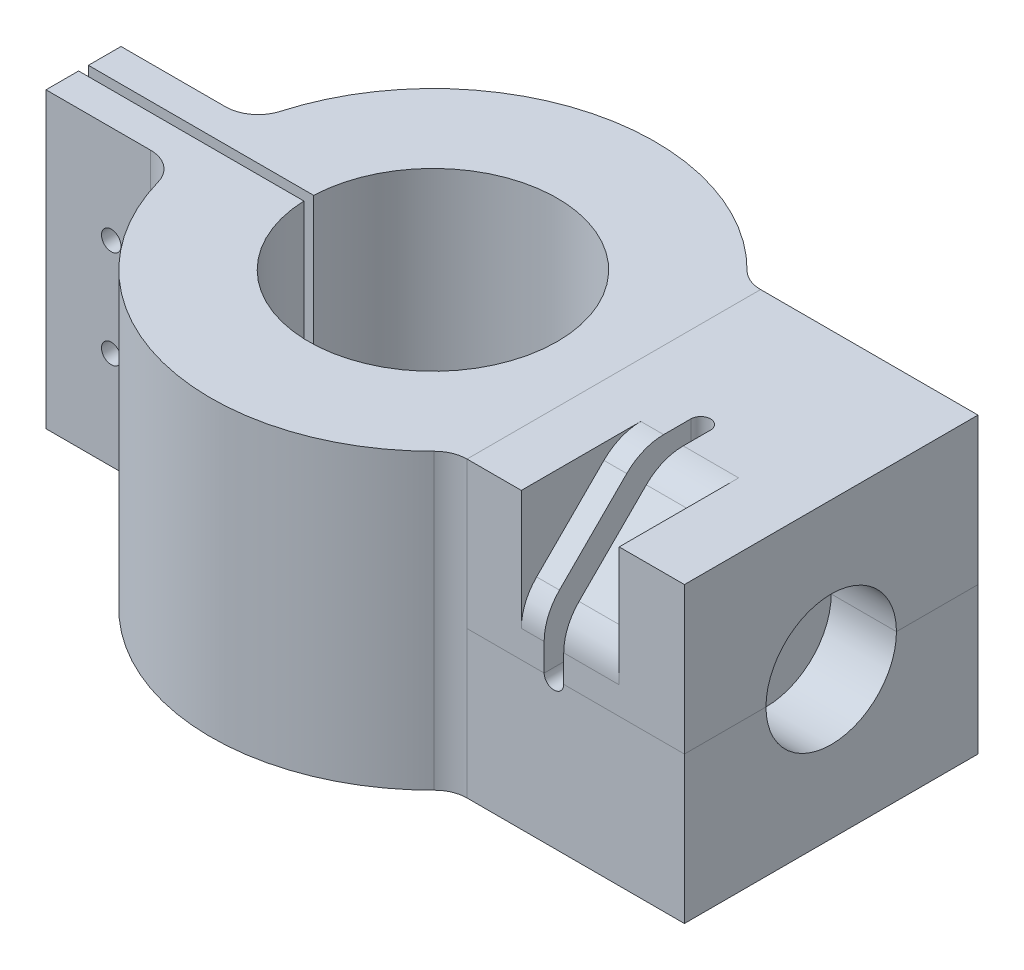
from build123d import *

# Parameters (mm, degrees)
BOSS_EXTRUDE1_DEPTH     = 22.5
F_3_0MM_DOWEL_HOLE1_D   = 3
BOSS_EXTRUDE2_START     = -8.493151603
BOSS_EXTRUDE2_OUTLINE_W = 45
BOSS_EXTRUDE2_OUTLINE_H = 45
BOSS_EXTRUDE2_DEPTH     = 35.493151603
SKETCH5_R               = 10
CUT_EXTRUDE1_DEPTH      = 40
CUT_EXTRUDE9_START      = -10
SKETCH16_R              = 19
CUT_EXTRUDE9_DEPTH      = 5
CUT_EXTRUDE2_START      = 22.5
SKETCH7_W               = 7.1
SKETCH7_H               = 45
CUT_EXTRUDE2_DEPTH      = 40
SKETCH8_W               = 22.5
SKETCH8_H               = 22.5
CUT_EXTRUDE3_DEPTH      = 1.5
CUT_EXTRUDE5_OUTLINE_W  = 1.5
CUT_EXTRUDE5_OUTLINE_H  = 12.613186919
CUT_EXTRUDE8_START      = 9
CUT_EXTRUDE8_DEPTH      = 14
CHAMFER1_START          = 36.05
CHAMFER1_DEPTH          = 15
FILLET3_R               = 5
FILLET4_R               = 8
SKETCH23_W              = 45
SKETCH23_H              = 40
SKETCH23_R              = 16
BOSS_EXTRUDE5_DEPTH     = 7.1
SPLIT1_START            = 27.724582954
SPLIT1_DEPTH            = 33.325417046
SPLIT1_START_2          = 51.05
SPLIT1_2_DEPTH          = 10
SPLIT1_START_3          = 36.05
SPLIT1_3_DEPTH          = 10
SPLIT1_4_DEPTH          = 8.325417046
SPLIT1_5_DEPTH          = 1.225417046
SPLIT1_START_4          = -1
SPLIT1_6_DEPTH          = 24
SPLIT1_7_DEPTH          = 22.5


with BuildPart() as part:
    # Sketch3 → Boss-Extrude1 (new, symmetric)
    with BuildSketch(Plane(origin=(0, 0, 0), x_dir=(1, 0, 0), z_dir=(0, 1, 0))):
        with BuildLine():
            Line((-53.560989258, 0.75), (-53.560989258, 5.75))
            Line((-53.560989258, 5.75), (-33.560989258, 5.75))
            ThreePointArc((-33.560989258, 5.75), (34.05, 0), (-33.560989258, -5.75))
            Line((-33.560989258, -5.75), (-53.560989258, -5.75))
            Line((-53.560989258, -5.75), (-53.560989258, -0.75))
            Line((-53.560989258, -0.75), (-19.035230495, -0.75))
            ThreePointArc((-19.035230495, -0.75), (19.05, 0), (-19.035230495, 0.75))
            Line((-19.035230495, 0.75), (-53.560989258, 0.75))
        make_face()
    extrude(amount=BOSS_EXTRUDE1_DEPTH, both=True)

    # Ø3.0mm Dowel Hole1 (through all)
    with Locations(Plane.XY.offset(5.75)):
        with Locations((-43.560989258, 7.5), (-43.560989258, -7.5)):
            Hole(F_3_0MM_DOWEL_HOLE1_D / 2)

    # Boss-Extrude2: read off the stored shape, not the designer's step
    # Boss-Extrude2 outline → Boss-Extrude2 (add)
    with BuildSketch(Plane(origin=(34.05, 0, 0), x_dir=(0, 0, -1), z_dir=(1, 0, 0)).offset(BOSS_EXTRUDE2_START)):
        Rectangle(BOSS_EXTRUDE2_OUTLINE_W, BOSS_EXTRUDE2_OUTLINE_H)
    extrude(amount=BOSS_EXTRUDE2_DEPTH)

    # Sketch5 → Cut-Extrude1 (cut)
    with BuildSketch(Plane(origin=(61.05, 0, 0), x_dir=(0, 0, -1), z_dir=(1, 0, 0))):
        Circle(SKETCH5_R)
    extrude(amount=-CUT_EXTRUDE1_DEPTH, mode=Mode.SUBTRACT)

    # Sketch16 → Cut-Extrude9 (cut)
    with BuildSketch(Plane(origin=(61.05, 0, 0), x_dir=(0, 0, -1), z_dir=(1, 0, 0)).offset(CUT_EXTRUDE9_START)):
        Circle(SKETCH16_R)
    extrude(amount=-CUT_EXTRUDE9_DEPTH, mode=Mode.SUBTRACT)

    # Sketch7 → Cut-Extrude2 (cut)
    with BuildSketch(Plane(origin=(0, 0, 0), x_dir=(1, 0, 0), z_dir=(0, 1, 0)).offset(CUT_EXTRUDE2_START)):
        with Locations((32.5, 0)):
            Rectangle(SKETCH7_W, SKETCH7_H)
    extrude(amount=-CUT_EXTRUDE2_DEPTH, mode=Mode.SUBTRACT)

    # Sketch8 → Cut-Extrude3 (cut, symmetric)
    with BuildSketch(Plane.ZY.offset(-41.05)):
        with Locations((11.25, 11.25)):
            Rectangle(SKETCH8_W, SKETCH8_H)
    extrude(amount=CUT_EXTRUDE3_DEPTH, both=True, mode=Mode.SUBTRACT)

    # Cut-Extrude5: read off the stored shape, not the designer's step
    # Cut-Extrude5 outline → Cut-Extrude5 (revolve, cut)
    with BuildSketch(Plane(origin=(41.05, 0, 0), x_dir=(1, 0, 0), z_dir=(0, -1, 0))):
        with Locations((0.75, 16.19340654)):
            Rectangle(CUT_EXTRUDE5_OUTLINE_W, CUT_EXTRUDE5_OUTLINE_H)
    revolve(axis=Axis((41.05, 0, 0), (0, 0, 1)), mode=Mode.SUBTRACT)

    # Cut-Extrude8: read off the stored shape, not the designer's step
    # Cut-Extrude8 outline → Cut-Extrude8 (cut)
    with BuildSketch(Plane(origin=(0, 0, 0), x_dir=(1, 0, 0), z_dir=(0, 1, 0)).offset(CUT_EXTRUDE8_START)):
        with BuildLine():
            ThreePointArc((42.55, 0), (41.05, 1.5), (39.55, 0))
            Line((39.55, 0), (42.55, 0))
        make_face()
    extrude(amount=CUT_EXTRUDE8_DEPTH, mode=Mode.SUBTRACT)

    # Chamfer1: read off the stored shape, not the designer's step
    # Chamfer1 outline → Chamfer1 (cut)
    with BuildSketch(Plane.YZ.offset(CHAMFER1_START)):
        Polygon((22.5, 22.5), (7.5, 22.5), (22.5, 7.5), align=None)
    extrude(amount=CHAMFER1_DEPTH, mode=Mode.SUBTRACT)

    # Fillet3
    fillet3_edges = [part.edges().sort_by_distance(p)[0] for p in [
        (-33.560989258, 0, -5.75),
        (-33.560989258, 0, 5.75),
        (25.556848397, 0, -22.5),
        (25.556848397, 0, 22.5),
    ]]
    fillet(fillet3_edges, radius=FILLET3_R)

    # Fillet4
    fillet4_edges = [part.edges().sort_by_distance(p)[0] for p in [
        (37.8, 22.5, 7.5),
        (46.8, 22.5, 7.5),
        (37.8, 7.5, 22.5),
        (46.8, 7.5, 22.5),
    ]]
    fillet(fillet4_edges, radius=FILLET4_R)

    # Sketch23 → Boss-Extrude5 (add)
    with BuildSketch(Plane(origin=(28.95, 0, 0), x_dir=(0, 0, -1), z_dir=(1, 0, 0))):
        with Locations((0, 2.5)):
            Rectangle(SKETCH23_W, SKETCH23_H)
        with Locations(Location((0, 0, 0), (0, 0, 180))):
            Circle(SKETCH23_R, mode=Mode.SUBTRACT)
    extrude(amount=BOSS_EXTRUDE5_DEPTH)

    # Split1 7 outline → Split1 7 (cut)
    with BuildSketch(Plane(origin=(0, 0, 0), x_dir=(1, 0, 0), z_dir=(0, 1, 0))):
        with BuildLine():
            Line((61.05, 22.5), (27.724582954, 22.5))
            Line((27.724582954, 22.5), (27.724582954, -22.5))
            Line((27.724582954, -22.5), (36.05, -22.5))
            Line((36.05, -22.5), (39.55, -22.5))
            Line((39.55, -22.5), (39.55, 0))
            ThreePointArc((39.55, 0), (41.05, 1.5), (42.55, 0))
            Line((42.55, 0), (42.55, -22.5))
            Line((42.55, -22.5), (51.05, -22.5))
            Line((51.05, -22.5), (61.05, -22.5))
            Line((61.05, -22.5), (61.05, 22.5))
        make_face()
    extrude(amount=SPLIT1_7_DEPTH, mode=Mode.SUBTRACT)


with BuildPart() as body_2:
    # Split1: read off the stored shape, not the designer's step
    # Split1 outline → Split1 (new body)
    with BuildSketch(Plane.YZ.offset(SPLIT1_START)):
        with BuildLine():
            Line((4.186291501, 22.5), (0, 22.5))
            Line((0, 22.5), (0, 19))
            ThreePointArc((0, 19), (19, 0), (0, -19))
            Line((0, -19), (0, -22.5))
            Line((0, -22.5), (22.5, -22.5))
            Line((22.5, -22.5), (22.5, 4.186291501))
            ThreePointArc((22.5, 4.186291501), (21.89103626, 7.24775896), (20.156854249, 9.843145751))
            Line((20.156854249, 9.843145751), (9.843145751, 20.156854249))
            ThreePointArc((9.843145751, 20.156854249), (7.24775896, 21.89103626), (4.186291501, 22.5))
        make_face()
    extrude(amount=SPLIT1_DEPTH)

    # Split1 2 outline → Split1 2 (add)
    with BuildSketch(Plane.YZ.offset(SPLIT1_START_2)):
        with BuildLine():
            ThreePointArc((0, -19), (19, 0), (0, 19))
            Line((0, 19), (0, 10))
            ThreePointArc((0, 10), (10, 0), (0, -10))
            Line((0, -10), (0, -19))
        make_face()
        with BuildLine():
            Line((22.5, 22.5), (4.186291501, 22.5))
            ThreePointArc((4.186291501, 22.5), (7.24775896, 21.89103626), (9.843145751, 20.156854249))
            Line((9.843145751, 20.156854249), (20.156854249, 9.843145751))
            ThreePointArc((20.156854249, 9.843145751), (21.89103626, 7.24775896), (22.5, 4.186291501))
            Line((22.5, 4.186291501), (22.5, 22.5))
        make_face()
    extrude(amount=SPLIT1_2_DEPTH)

    # Split1 3 outline → Split1 3 (add)
    with BuildSketch(Plane.YZ.offset(SPLIT1_START_3)):
        with BuildLine():
            ThreePointArc((0, -19), (19, 0), (0, 19))
            Line((0, 19), (0, 10))
            ThreePointArc((0, 10), (10, 0), (0, -10))
            Line((0, -10), (0, -19))
        make_face()
    extrude(amount=SPLIT1_3_DEPTH)

    # Split1 4 outline → Split1 4 (add)
    with BuildSketch(Plane.YZ.offset(SPLIT1_START)):
        with BuildLine():
            ThreePointArc((0, -19), (19, 0), (0, 19))
            Line((0, 19), (0, 16))
            ThreePointArc((0, 16), (16, 0), (0, -16))
            Line((0, -16), (0, -19))
        make_face()
        with BuildLine():
            Line((22.5, 22.5), (4.186291501, 22.5))
            ThreePointArc((4.186291501, 22.5), (7.24775896, 21.89103626), (9.843145751, 20.156854249))
            Line((9.843145751, 20.156854249), (20.156854249, 9.843145751))
            ThreePointArc((20.156854249, 9.843145751), (21.89103626, 7.24775896), (22.5, 4.186291501))
            Line((22.5, 4.186291501), (22.5, 22.5))
        make_face()
    extrude(amount=SPLIT1_4_DEPTH)

    # Split1 5 outline → Split1 5 (add)
    with BuildSketch(Plane.YZ.offset(SPLIT1_START)):
        with BuildLine():
            ThreePointArc((0, -16), (16, 0), (0, 16))
            Line((0, 16), (0, 10))
            ThreePointArc((0, 10), (10, 0), (0, -10))
            Line((0, -10), (0, -16))
        make_face()
    extrude(amount=SPLIT1_5_DEPTH)

    # Split1 6 outline → Split1 6 (cut)
    with BuildSketch(Plane(origin=(0, 0, 0), x_dir=(1, 0, 0), z_dir=(0, 1, 0)).offset(SPLIT1_START_4)):
        with BuildLine():
            Line((39.55, 0), (39.55, -22.5))
            Line((39.55, -22.5), (42.55, -22.5))
            Line((42.55, -22.5), (42.55, 0))
            ThreePointArc((42.55, 0), (41.05, 1.5), (39.55, 0))
        make_face()
    extrude(amount=SPLIT1_6_DEPTH, mode=Mode.SUBTRACT)


solid = Compound([part.part, body_2.part])
